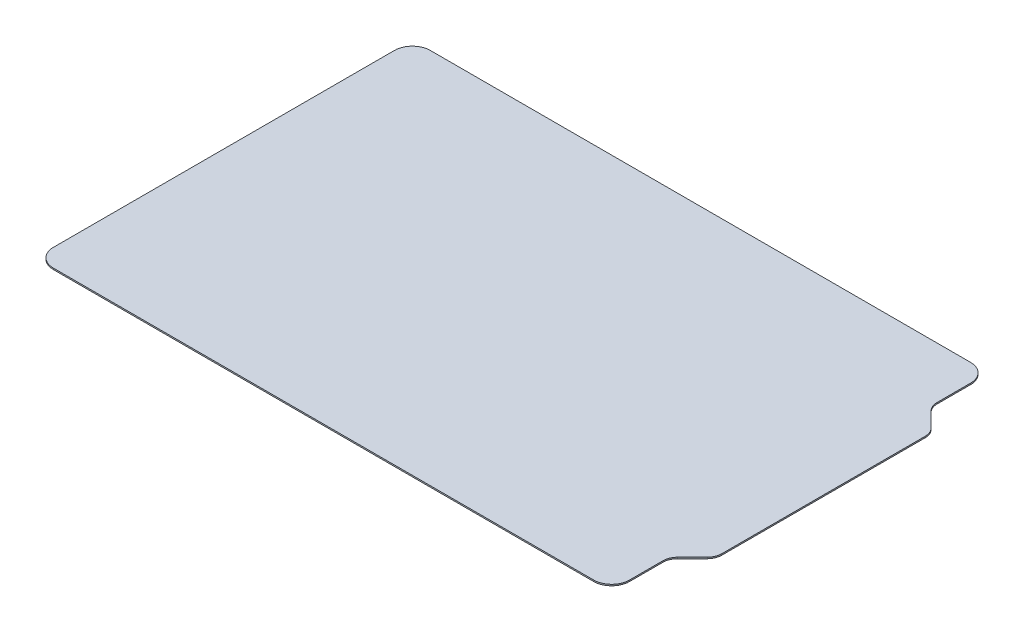
from build123d import *

# Parameters (mm, degrees)
SKETCH1_W           = 334
SKETCH1_H           = 210
BOSS_EXTRUDE1_DEPTH = 0.76
CUT_EXTRUDE1_DEPTH  = 0.76
FILLET1_R           = 8
FILLET2_R           = 10


with BuildPart() as part:
    # Sketch1 → Boss-Extrude1 (new body)
    with BuildSketch(Plane(origin=(0, 0, 0), x_dir=(1, 0, 0), z_dir=(0, 1, 0))):
        Rectangle(SKETCH1_W, SKETCH1_H)
    extrude(amount=BOSS_EXTRUDE1_DEPTH)

    # Sketch2 → Cut-Extrude1 (cut)
    with BuildSketch(Plane(origin=(0, 0, 0), x_dir=(-1, 0, 0), z_dir=(0, -1, 0))):
        Polygon((-167, -60), (-154, -73), (-154, -105), (-167, -105), align=None)
        Polygon((-154, 105), (-167, 105), (-167, 60), (-154, 73), align=None)
    extrude(amount=-CUT_EXTRUDE1_DEPTH, mode=Mode.SUBTRACT)

    # Fillet1
    fillet1_edges = [part.edges().sort_by_distance(p)[0] for p in [
        (154, 0.38, -73),
        (167, 0.38, -60),
        (154, 0.38, 73),
        (167, 0.38, 60),
    ]]
    fillet(fillet1_edges, radius=FILLET1_R)

    # Fillet2
    fillet2_edges = [part.edges().sort_by_distance(p)[0] for p in [
        (154, 0.38, -105),
        (-167, 0.38, -105),
        (-167, 0.38, 105),
        (154, 0.38, 105),
    ]]
    fillet(fillet2_edges, radius=FILLET2_R)


solid = part.part
